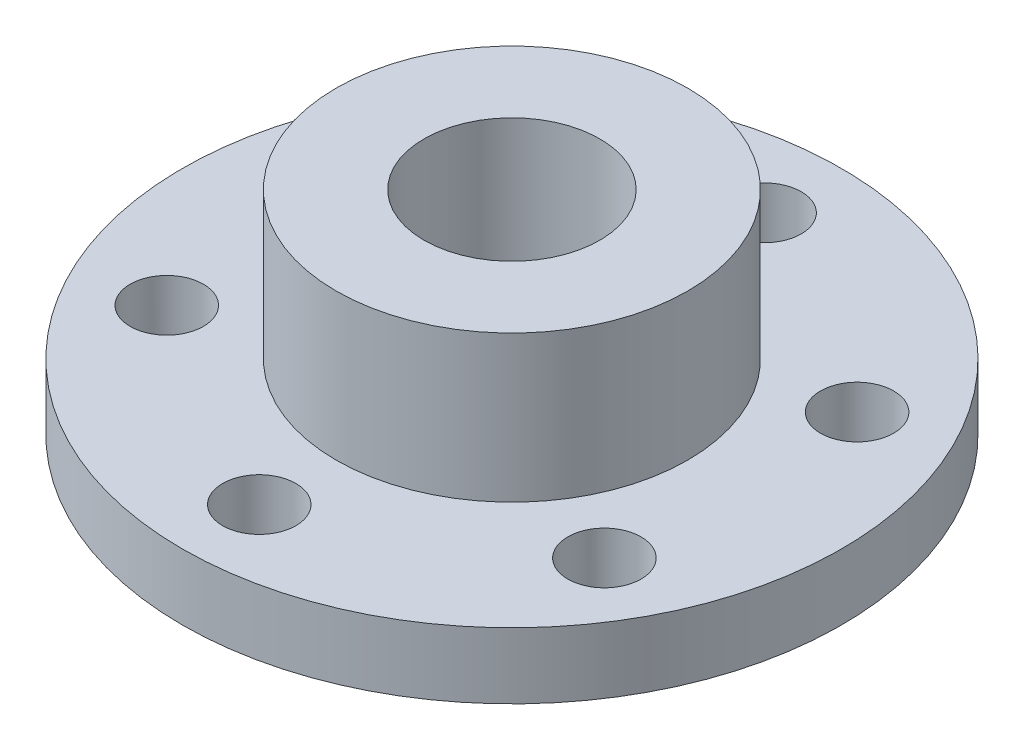
from build123d import *

# Parameters (mm, degrees)
SKETCH1_R           = 22.5
BOSS_EXTRUDE1_DEPTH = 4.5
SKETCH2_R           = 12
BOSS_EXTRUDE2_DEPTH = 10
SKETCH3_R           = 6
CUT_EXTRUDE1_DEPTH  = 21
SKETCH4_R           = 2.5
CUT_EXTRUDE2_DEPTH  = 10


with BuildPart() as part:
    # Sketch1 → Boss-Extrude1 (new body)
    with BuildSketch(Plane(origin=(0, 0, 0), x_dir=(1, 0, 0), z_dir=(0, 1, 0))):
        Circle(SKETCH1_R)
    extrude(amount=BOSS_EXTRUDE1_DEPTH)

    # Sketch2 → Boss-Extrude2 (add)
    with BuildSketch(Plane(origin=(0, 4.5, 0), x_dir=(1, 0, 0), z_dir=(0, 1, 0))):
        Circle(SKETCH2_R)
    extrude(amount=BOSS_EXTRUDE2_DEPTH)

    # Sketch3 → Cut-Extrude1 (cut)
    with BuildSketch(Plane(origin=(0, 14.5, 0), x_dir=(1, 0, 0), z_dir=(0, 1, 0))):
        Circle(SKETCH3_R)
    extrude(amount=-CUT_EXTRUDE1_DEPTH, mode=Mode.SUBTRACT)

    # Sketch4 → Cut-Extrude2 (cut)
    with BuildSketch(Plane.XZ):
        with Locations((0, 17.25)):
            Circle(SKETCH4_R)
        with Locations((14.938938215, 8.625)):
            Circle(SKETCH4_R)
        with Locations((14.938938215, -8.625)):
            Circle(SKETCH4_R)
        with Locations((0, -17.25)):
            Circle(SKETCH4_R)
        with Locations((-14.938938215, -8.625)):
            Circle(SKETCH4_R)
        with Locations((-14.938938215, 8.625)):
            Circle(SKETCH4_R)
    extrude(amount=-CUT_EXTRUDE2_DEPTH, mode=Mode.SUBTRACT)


solid = part.part
